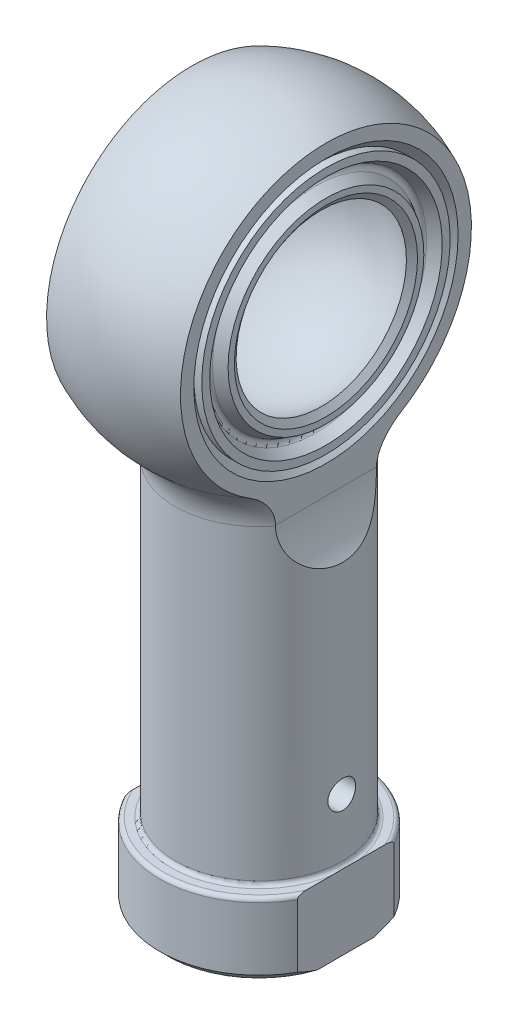
from build123d import *

# Parameters (mm, degrees)
CHAMFER1_SIZE           = 0.508
FILLET1_R               = 3.048
FILLET2_R               = 0.254
CUT_EXTRUDE1_DEPTH      = 48.42460929
CUT_EXTRUDE1_DEPTH_BACK = 48.42460929
SKETCH2_OUTSIDE_W       = 33.2
SKETCH2_OUTSIDE_H       = 57.889
CUT_EXTRUDE2_DEPTH      = 47.638129969
CUT_EXTRUDE2_DEPTH_BACK = 47.638129969
SKETCH3_R               = 7.9375
SKETCH3_R_2             = 0.889
CHAMFER2_SIZE           = 0.508


with BuildPart() as part:
    # Sketch1 → Revolve1 (revolve)
    with BuildSketch(Plane.XY):
        with BuildLine():
            Line((3.571875, 0), (6.35, 0))
            Line((6.35, 0), (6.35, 4.7752))
            Line((6.35, 4.7752), (5.3594, 4.7752))
            Line((5.3594, 4.7752), (5.3594, 26.203955219))
            ThreePointArc((5.3594, 26.203955219), (9.850130685, 37.709729058), (0, 45.1612))
            Line((0, 45.1612), (0, 34.925))
            Line((0, 34.925), (0.889, 34.036))
            Line((0.889, 34.036), (0.889, 23.684415336))
            Line((0.889, 23.684415336), (3.317875, 22.225))
            Line((3.317875, 22.225), (3.317875, 19.05))
            Line((3.317875, 19.05), (3.571875, 19.05))
            Line((3.571875, 19.05), (3.571875, 0))
        make_face()
    revolve(axis=Axis((0, -1004.593899687, 0), (0, 1, 0)))

    # Chamfer1
    chamfer1_edges = [part.edges().sort_by_distance(p)[0] for p in [
        (-6.35, 0, 0),
    ]]
    chamfer(chamfer1_edges, length=CHAMFER1_SIZE)

    # Fillet1
    fillet1_edges = [part.edges().sort_by_distance(p)[0] for p in [
        (-5.3594, 26.203955219, 0),
    ]]
    fillet(fillet1_edges, radius=FILLET1_R)

    # Fillet2
    fillet2_edges = [part.edges().sort_by_distance(p)[0] for p in [
        (-6.35, 4.7752, 0),
        (-5.3594, 4.7752, 0),
    ]]
    fillet(fillet2_edges, radius=FILLET2_R)

    # Sketch2 outside → Cut-Extrude1 (cut, two sides: drawn at the far end of the back side and taken through both)
    with BuildSketch(Plane.XY.offset(-CUT_EXTRUDE1_DEPTH_BACK)):
        with Locations((0, 22.5805)):
            Rectangle(SKETCH2_OUTSIDE_W, SKETCH2_OUTSIDE_H)
        with BuildLine():
            Line((-5.5499, 0), (5.5499, 0))
            Line((5.5499, 0), (5.5499, 21.328695835))
            ThreePointArc((5.5499, 21.328695835), (4.607995119, 22.892748776), (4.2799, 24.6888))
            Line((4.2799, 24.6888), (4.2799, 45.1612))
            Line((4.2799, 45.1612), (-4.2799, 45.1612))
            Line((-4.2799, 45.1612), (-4.2799, 24.6888))
            ThreePointArc((-4.2799, 24.6888), (-4.607995119, 22.892748776), (-5.5499, 21.328695835))
            Line((-5.5499, 21.328695835), (-5.5499, 0))
        make_face(mode=Mode.SUBTRACT)
    extrude(amount=CUT_EXTRUDE1_DEPTH + CUT_EXTRUDE1_DEPTH_BACK, mode=Mode.SUBTRACT)

    # Sketch3 → Cut-Extrude2 (cut, two sides: drawn at the far end of the back side and taken through both)
    with BuildSketch(Plane(origin=(0, 0, 0), x_dir=(0, 0, -1), z_dir=(1, 0, 0)).offset(-CUT_EXTRUDE2_DEPTH_BACK)):
        with Locations((0, 34.925)):
            Circle(SKETCH3_R)
        with Locations((0, 8.71855)):
            Circle(SKETCH3_R_2)
    extrude(amount=CUT_EXTRUDE2_DEPTH + CUT_EXTRUDE2_DEPTH_BACK, mode=Mode.SUBTRACT)

    # Chamfer2
    chamfer2_edges = [part.edges().sort_by_distance(p)[0] for p in [
        (-4.2799, 34.925, 7.9375),
        (4.2799, 34.925, 7.9375),
    ]]
    chamfer(chamfer2_edges, length=CHAMFER2_SIZE)


with BuildPart() as body_2:
    # Sketch4 → Revolve2 (revolve)
    with BuildSketch(Plane.XY):
        with BuildLine():
            Line((3.980082137, 40.368935697), (4.2799, 40.779025015))
            Line((4.2799, 40.779025015), (4.2799, 41.181324253))
            Line((4.2799, 41.181324253), (3.6449, 41.547941674))
            ThreePointArc((3.6449, 41.547941674), (3.5179, 41.767912127), (3.6449, 41.987882579))
            Line((3.6449, 41.987882579), (4.2799, 42.3545))
            Line((4.2799, 42.3545), (4.2799, 42.8625))
            Line((4.2799, 42.8625), (-4.2799, 42.8625))
            Line((-4.2799, 42.8625), (-4.2799, 42.3545))
            Line((-4.2799, 42.3545), (-3.6449, 41.987882579))
            ThreePointArc((-3.6449, 41.987882579), (-3.5179, 41.767912127), (-3.6449, 41.547941674))
            Line((-3.6449, 41.547941674), (-4.2799, 41.181324253))
            Line((-4.2799, 41.181324253), (-4.2799, 40.779025015))
            Line((-4.2799, 40.779025015), (-3.980082137, 40.368935697))
            ThreePointArc((-3.980082137, 40.368935697), (0, 41.6687), (3.980082137, 40.368935697))
        make_face()
    revolve(axis=Axis((-14.449204668, 34.925, 0), (1, 0, 0)))


solid = Compound([part.part, body_2.part])
